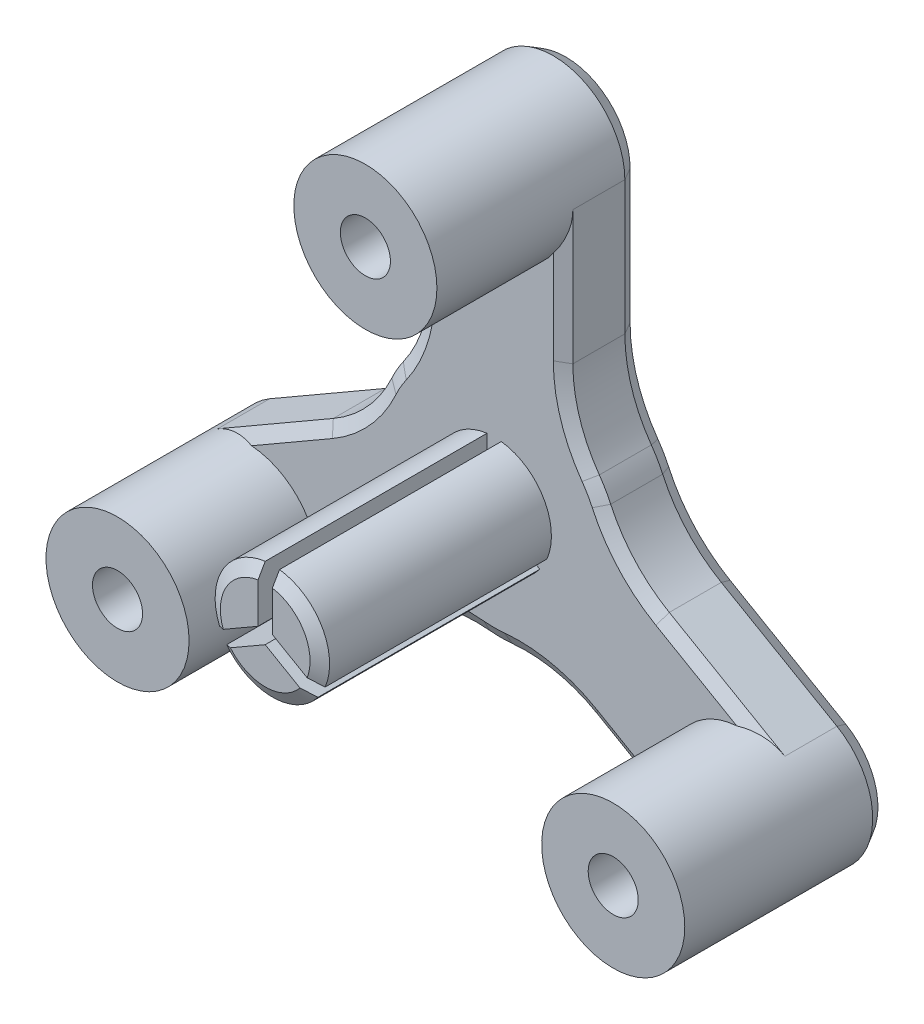
from build123d import *

# Parameters (mm, degrees)
BOSS_EXTRUDE1_DEPTH   = 5
SKETCH2_R             = 5
SKETCH2_R_2           = 1.75
BOSS_EXTRUDE2_DEPTH   = 9
BOSS_EXTRUDE3_DEPTH   = 7
SKETCH4_R             = 1.75
CUT_EXTRUDE1_DEPTH    = 38.137650447
CUT_EXTRUDE3_DEPTH    = 3
CHAMFER1_SIZE         = 0.5
CHAMFER1_SIZE2        = 0.866025404
CHAMFER2_SIZE         = 0.5
CHAMFER2_SIZE_2       = 0.866025404
BOSS_EXTRUDE5_START   = 0.15
SKETCH8_R             = 2.25
SKETCH8_R_2           = 1.75
BOSS_EXTRUDE5_DEPTH   = 2.85
BOSS_EXTRUDE5_2_DEPTH = 2.85
BOSS_EXTRUDE5_3_DEPTH = 2.85


with BuildPart() as part:
    # Sketch1 → Boss-Extrude1 (new body)
    with BuildSketch(Plane.XY):
        with BuildLine():
            Line((-5, 20), (-5, 10.668282009))
            ThreePointArc((-5, 10.668282009), (-5.473946579, 7.626192889), (-6.850861242, 4.872461316))
            ThreePointArc((-6.850861242, 4.872461316), (-7.28054835, 4.20342655), (-7.6451059, 3.496789216))
            ThreePointArc((-7.6451059, 3.496789216), (-9.341450066, 0.927480351), (-11.739003235, -1.004013986))
            Line((-11.739003235, -1.004013986), (-19.820508076, -5.669872981))
            ThreePointArc((-19.820508076, -5.669872981), (-21.650635095, -12.5), (-14.820508076, -14.330127019))
            Line((-14.820508076, -14.330127019), (-6.739003235, -9.664268023))
            ThreePointArc((-6.739003235, -9.664268023), (-3.867503487, -8.553673241), (-0.794244657, -8.369250532))
            ThreePointArc((-0.794244657, -8.369250532), (0, -8.406853099), (0.794244657, -8.369250532))
            ThreePointArc((0.794244657, -8.369250532), (3.867503487, -8.553673241), (6.739003235, -9.664268023))
            Line((6.739003235, -9.664268023), (14.820508076, -14.330127019))
            ThreePointArc((14.820508076, -14.330127019), (21.650635095, -12.5), (19.820508076, -5.669872981))
            Line((19.820508076, -5.669872981), (11.739003235, -1.004013986))
            ThreePointArc((11.739003235, -1.004013986), (9.341450066, 0.927480351), (7.6451059, 3.496789216))
            ThreePointArc((7.6451059, 3.496789216), (7.28054835, 4.20342655), (6.850861242, 4.872461316))
            ThreePointArc((6.850861242, 4.872461316), (5.473946579, 7.626192889), (5, 10.668282009))
            Line((5, 10.668282009), (5, 20))
            ThreePointArc((5, 20), (0, 25), (-5, 20))
        make_face()
    extrude(amount=BOSS_EXTRUDE1_DEPTH)

    # Sketch2 → Boss-Extrude2 (add)
    # profile 1 of 6: a face of its own
    with BuildSketch(Plane.XY.offset(5)):
        with Locations(Location((17.320508076, -10, 0), (0, 0, 240))):
            Circle(SKETCH2_R)
        with Locations((17.320508076, -10)):
            Circle(SKETCH2_R_2, mode=Mode.SUBTRACT)
    # profile 2 of 6: a face of its own
    with BuildSketch(Plane.XY.offset(5)):
        with Locations(Location((-17.320508076, -10, 0), (0, 0, 120))):
            Circle(SKETCH2_R)
        with Locations((-17.320508076, -10)):
            Circle(SKETCH2_R_2, mode=Mode.SUBTRACT)
    # profile 3 of 6: a face of its own
    with BuildSketch(Plane.XY.offset(5)):
        with Locations((0, 20)):
            Circle(SKETCH2_R)
        with Locations((0, 20)):
            Circle(SKETCH2_R_2, mode=Mode.SUBTRACT)
    # profile 4 of 6: a face of its own
    with BuildSketch(Plane.XY.offset(5)):
        with BuildLine():
            ThreePointArc((3.686931771, -1.551300781), (3.464101615, 2), (0.5, 3.968626967))
            Line((0.5, 3.968626967), (0.5, 0.288675135))
            Line((0.5, 0.288675135), (3.686931771, -1.551300781))
        make_face()
    # profile 5 of 6: a face of its own
    with BuildSketch(Plane.XY.offset(5)):
        with BuildLine():
            Line((-0.5, 0.288675135), (-0.5, 3.968626967))
            ThreePointArc((-0.5, 3.968626967), (-3.464101615, 2), (-3.686931771, -1.551300781))
            Line((-3.686931771, -1.551300781), (-0.5, 0.288675135))
        make_face()
    # profile 6 of 6: a face of its own
    with BuildSketch(Plane.XY.offset(5)):
        with BuildLine():
            ThreePointArc((-3.186931771, -2.417326185), (0, -4), (3.186931771, -2.417326185))
            Line((3.186931771, -2.417326185), (0, -0.577350269))
            Line((0, -0.577350269), (-3.186931771, -2.417326185))
        make_face()
    extrude(amount=BOSS_EXTRUDE2_DEPTH)

    # Sketch3 → Boss-Extrude3 (add)
    with BuildSketch(Plane.XY.offset(14)):
        with BuildLine():
            Line((-0.5, 0.288675135), (-0.5, 3.968626967))
            ThreePointArc((-0.5, 3.968626967), (-3.464101615, 2), (-3.686931771, -1.551300781))
            Line((-3.686931771, -1.551300781), (-0.5, 0.288675135))
        make_face()
        with BuildLine():
            Line((0.5, 0.288675135), (3.686931771, -1.551300781))
            ThreePointArc((3.686931771, -1.551300781), (3.464101615, 2), (0.5, 3.968626967))
            Line((0.5, 3.968626967), (0.5, 0.288675135))
        make_face()
        with BuildLine():
            Line((0, -0.577350269), (-3.186931771, -2.417326185))
            ThreePointArc((-3.186931771, -2.417326185), (0, -4), (3.186931771, -2.417326185))
            Line((3.186931771, -2.417326185), (0, -0.577350269))
        make_face()
    extrude(amount=BOSS_EXTRUDE3_DEPTH)

    # Sketch4 → Cut-Extrude1 (cut, through all)
    with BuildSketch(Plane.XY.offset(5)):
        with Locations((17.320508076, -10)):
            Circle(SKETCH4_R)
        with Locations((0, 20)):
            Circle(SKETCH4_R)
        with Locations((-17.320508076, -10)):
            Circle(SKETCH4_R)
    extrude(amount=-CUT_EXTRUDE1_DEPTH, mode=Mode.SUBTRACT)

    # Sketch7 → Cut-Extrude3 (cut)
    with BuildSketch(Plane(origin=(0, 0, 0), x_dir=(-1, 0, 0), z_dir=(0, 0, -1))):
        Polygon((14.495508076, -8.36898549), (14.495508076, -11.63101451), (17.320508076, -13.262029021), (20.145508076, -11.63101451), (20.145508076, -8.36898549), (17.320508076, -6.737970979), align=None)
        Polygon((0, 16.737970979), (2.825, 18.36898549), (2.825, 21.63101451), (0, 23.262029021), (-2.825, 21.63101451), (-2.825, 18.36898549), align=None)
        Polygon((-14.495508076, -8.36898549), (-17.320508076, -6.737970979), (-20.145508076, -8.36898549), (-20.145508076, -11.63101451), (-17.320508076, -13.262029021), (-14.495508076, -11.63101451), align=None)
    extrude(amount=-CUT_EXTRUDE3_DEPTH, mode=Mode.SUBTRACT)

    # Chamfer1
    chamfer1_edges = [part.edges().sort_by_distance(p)[0] for p in [
        (7.28054835, 4.20342655, 0),
        (9.341450066, 0.927480351, 0),
        (15.779755655, -3.336943483, 0),
        (21.650635095, -12.5, 0),
        (10.779755655, -11.997197521, 0),
        (3.867503487, -8.553673241, 0),
        (0, -8.406853099, 0),
        (-3.867503487, -8.553673241, 0),
        (-10.779755655, -11.997197521, 0),
        (-21.650635095, -12.5, 0),
        (-15.779755655, -3.336943483, 0),
        (-9.341450066, 0.927480351, 0),
        (-7.28054835, 4.20342655, 0),
        (-5.473946579, 7.626192889, 0),
        (-5, 15.334141004, 0),
        (0, 25, 0),
        (5, 15.334141004, 0),
        (5.473946579, 7.626192889, 0),
    ]]
    chamfer1_side = [part.faces().sort_by_distance(p)[0] for p in [
        (0, 0, 0),
    ]]
    chamfer(chamfer1_edges, length=CHAMFER1_SIZE, length2=CHAMFER1_SIZE2, reference=chamfer1_side[0])

    # Chamfer2
    # the kernel refuses this chamfer: 0.866025404, 0.5 mm, written as the material it takes off along each edge
    with BuildSketch(Plane(origin=(0, 0, 21), x_dir=(0.421503526327494, 0.9068267625591382, 0), z_dir=(0.9068267625591382, -0.421503526327494, 0))) as chamfer2_piece_1:
        Polygon((4, -CHAMFER2_SIZE), (4 - CHAMFER2_SIZE_2, 0), (4, 0), align=None)
    revolve(axis=Axis((0, 0, 21), (0, 0, 1)), revolution_arc=169.859095672, mode=Mode.SUBTRACT)
    with BuildSketch(Plane(origin=(0, 0, 21), x_dir=(0.574583250044062, -0.8184461428639046, 0), z_dir=(-0.8184461428639046, -0.574583250044062, 0))) as chamfer2_piece_2:
        Polygon((4, -CHAMFER2_SIZE), (4 - CHAMFER2_SIZE_2, 0), (4, 0), align=None)
    revolve(axis=Axis((0, 0, 21), (0, 0, 1)), revolution_arc=169.859095672, mode=Mode.SUBTRACT)
    with BuildSketch(Plane(origin=(0, 0, 21), x_dir=(-0.9960867763715608, -0.08838061969522747, 0), z_dir=(-0.08838061969522747, 0.9960867763715608, 0))) as chamfer2_piece_3:
        Polygon((4, -CHAMFER2_SIZE), (4 - CHAMFER2_SIZE_2, 0), (4, 0), align=None)
    revolve(axis=Axis((0, 0, 21), (0, 0, 1)), revolution_arc=169.859095672, mode=Mode.SUBTRACT)
    with BuildSketch(Plane(origin=(-5, 22.240481985, 5), x_dir=(0.9998132206222079, 0, 0.019326765612700702), z_dir=(0, -1, 0))) as chamfer2_piece_4_section:
        Polygon((CHAMFER2_SIZE_2 * 0.999813220373, -CHAMFER2_SIZE_2 * 0.0193267656079), (-CHAMFER2_SIZE * 0.0193267656127, -CHAMFER2_SIZE * 0.999813220622), (0, 0), align=None)
    chamfer2_piece_4 = extrude(amount=11.572199976, mode=Mode.PRIVATE)
    chamfer2_piece_4 = chamfer2_piece_4 - Plane(origin=(0, 20, 4.828748489), x_dir=(1, 0, 0), z_dir=(0, 0, -1)) * Cylinder(5, 27, mode=Mode.PRIVATE)
    add(chamfer2_piece_4, mode=Mode.SUBTRACT)
    with BuildSketch(Plane(origin=(-15, 10.668282009, 5), x_dir=(1, 0, 0), z_dir=(0, 1, 0))) as chamfer2_piece_5:
        Polygon((10 + CHAMFER2_SIZE_2, 0), (10, CHAMFER2_SIZE), (10, 0), align=None)
    revolve(axis=Axis((-15, 10.668282009, 5), (0, 0, -1)), revolution_arc=35.421152989, mode=Mode.SUBTRACT)
    with BuildSketch(Plane(origin=(0, 0, 5), x_dir=(-0.8149138757719532, 0.5795820693174815, 0), z_dir=(0.5795820693174815, 0.8149138757719532, 0))) as chamfer2_piece_6:
        Polygon((8.406853099 - CHAMFER2_SIZE_2, 0), (8.406853099, -CHAMFER2_SIZE), (8.406853099, 0), align=None)
    revolve(axis=Axis((0, 0, 5), (0, 0, 1)), revolution_arc=10.842305977, mode=Mode.SUBTRACT)
    with BuildSketch(Plane(origin=(-16.739003235, 7.656240052, 5), x_dir=(0.9093897334928682, -0.41594508365620836, 0), z_dir=(0.41594508365620836, 0.9093897334928682, 0))) as chamfer2_piece_7:
        Polygon((10 + CHAMFER2_SIZE_2, 0), (10, CHAMFER2_SIZE), (10, 0), align=None)
    revolve(axis=Axis((-16.739003235, 7.656240052, 5), (0, 0, -1)), revolution_arc=35.421152989, mode=Mode.SUBTRACT)
    with BuildSketch(Plane(origin=(-11.739003235, -1.004013986, 5), x_dir=(0.4999066103111042, -0.8658636480983676, 0.01932676561270069), z_dir=(-0.8660254037844386, -0.5000000000000003, 0))) as chamfer2_piece_8_section:
        Polygon((CHAMFER2_SIZE_2 * 0.999813220373, -CHAMFER2_SIZE_2 * 0.0193267656079), (-CHAMFER2_SIZE * 0.0193267656127, -CHAMFER2_SIZE * 0.999813220622), (0, 0), align=None)
    chamfer2_piece_8 = extrude(amount=11.572199976, mode=Mode.PRIVATE)
    chamfer2_piece_8 = chamfer2_piece_8 - Plane(origin=(-17.320508076, -10, 4.82874849), x_dir=(-0.49999999999999634, 0.8660254037844408, 0), z_dir=(0, 0, -1)) * Cylinder(5, 27, mode=Mode.PRIVATE)
    add(chamfer2_piece_8, mode=Mode.SUBTRACT)
    with BuildSketch(Plane(origin=(-16.760822392, -15.450368012, 5), x_dir=(-0.4999066103111033, 0.8658636480983681, 0.019326765612700702), z_dir=(0.8660254037844392, 0.49999999999999933, 0))) as chamfer2_piece_9_section:
        Polygon((CHAMFER2_SIZE_2 * 0.999813220373, -CHAMFER2_SIZE_2 * 0.0193267656079), (-CHAMFER2_SIZE * 0.0193267656127, -CHAMFER2_SIZE * 0.999813220622), (0, 0), align=None)
    chamfer2_piece_9 = extrude(amount=11.572199976, mode=Mode.PRIVATE)
    chamfer2_piece_9 = chamfer2_piece_9 - Plane(origin=(-17.320508076, -10, 4.828748489), x_dir=(-0.49999999999999634, 0.8660254037844408, 0), z_dir=(0, 0, -1)) * Cylinder(5, 27, mode=Mode.PRIVATE)
    add(chamfer2_piece_9, mode=Mode.SUBTRACT)
    with BuildSketch(Plane(origin=(-1.739003235, -18.324522061, 5), x_dir=(-0.5000000000000002, 0.8660254037844386, 0), z_dir=(-0.8660254037844386, -0.5000000000000002, 0))) as chamfer2_piece_10:
        Polygon((10 + CHAMFER2_SIZE_2, 0), (10, CHAMFER2_SIZE), (10, 0), align=None)
    revolve(axis=Axis((-1.739003235, -18.324522061, 5), (0, 0, -1)), revolution_arc=35.421152989, mode=Mode.SUBTRACT)
    with BuildSketch(Plane(origin=(0, 0, 5), x_dir=(-0.09447585772091267, -0.9955271529736884, 0), z_dir=(-0.9955271529736884, 0.09447585772091267, 0))) as chamfer2_piece_11:
        Polygon((8.406853099 - CHAMFER2_SIZE_2, 0), (8.406853099, -CHAMFER2_SIZE), (8.406853099, 0), align=None)
    revolve(axis=Axis((0, 0, 5), (0, 0, 1)), revolution_arc=10.842305977, mode=Mode.SUBTRACT)
    with BuildSketch(Plane(origin=(15, 10.668282009, 5), x_dir=(-0.814913875771955, -0.579582069317479, 0), z_dir=(0.579582069317479, -0.814913875771955, 0))) as chamfer2_piece_12:
        Polygon((10, CHAMFER2_SIZE), (10 + CHAMFER2_SIZE_2, 0), (10, 0), align=None)
    revolve(axis=Axis((15, 10.668282009, 5), (0, 0, -1)), revolution_arc=35.421152989, mode=Mode.SUBTRACT)
    with BuildSketch(Plane(origin=(1.739003235, -18.324522061, 5), x_dir=(-0.09447585772091491, 0.9955271529736883, 0), z_dir=(-0.9955271529736883, -0.09447585772091491, 0))) as chamfer2_piece_13:
        Polygon((10 + CHAMFER2_SIZE_2, 0), (10, CHAMFER2_SIZE), (10, 0), align=None)
    revolve(axis=Axis((1.739003235, -18.324522061, 5), (0, 0, -1)), revolution_arc=35.421152989, mode=Mode.SUBTRACT)
    with BuildSketch(Plane(origin=(6.739003235, -9.664268023, 5), x_dir=(0.4999066103111033, 0.865863648098368, 0.019326765612700712), z_dir=(0.866025403784439, -0.49999999999999933, 0))) as chamfer2_piece_14_section:
        Polygon((CHAMFER2_SIZE_2 * 0.999813220373, -CHAMFER2_SIZE_2 * 0.0193267656079), (-CHAMFER2_SIZE * 0.0193267656127, -CHAMFER2_SIZE * 0.999813220622), (0, 0), align=None)
    chamfer2_piece_14 = extrude(amount=11.572199976, mode=Mode.PRIVATE)
    chamfer2_piece_14 = chamfer2_piece_14 - Plane(origin=(17.320508076, -10, 4.82874849), x_dir=(-0.5000000000000019, -0.8660254037844376, 0), z_dir=(0, 0, -1)) * Cylinder(5, 27, mode=Mode.PRIVATE)
    add(chamfer2_piece_14, mode=Mode.SUBTRACT)
    with BuildSketch(Plane(origin=(21.760822392, -6.790113974, 5), x_dir=(-0.499906610311104, -0.8658636480983676, 0.01932676561270072), z_dir=(-0.8660254037844387, 0.5000000000000001, 0))) as chamfer2_piece_15_section:
        Polygon((CHAMFER2_SIZE_2 * 0.999813220373, -CHAMFER2_SIZE_2 * 0.0193267656079), (-CHAMFER2_SIZE * 0.0193267656127, -CHAMFER2_SIZE * 0.999813220622), (0, 0), align=None)
    chamfer2_piece_15 = extrude(amount=11.572199976, mode=Mode.PRIVATE)
    chamfer2_piece_15 = chamfer2_piece_15 - Plane(origin=(17.320508076, -10, 4.828748489), x_dir=(-0.5000000000000019, -0.8660254037844376, 0), z_dir=(0, 0, -1)) * Cylinder(5, 27, mode=Mode.PRIVATE)
    add(chamfer2_piece_15, mode=Mode.SUBTRACT)
    with BuildSketch(Plane(origin=(16.739003235, 7.656240052, 5), x_dir=(-0.5000000000000013, -0.8660254037844379, 0), z_dir=(0.8660254037844379, -0.5000000000000013, 0))) as chamfer2_piece_16:
        Polygon((10 + CHAMFER2_SIZE_2, 0), (10, CHAMFER2_SIZE), (10, 0), align=None)
    revolve(axis=Axis((16.739003235, 7.656240052, 5), (0, 0, -1)), revolution_arc=35.421152989, mode=Mode.SUBTRACT)
    with BuildSketch(Plane(origin=(0, 0, 5), x_dir=(0.9093897334928667, 0.41594508365621186, 0), z_dir=(0.41594508365621186, -0.9093897334928667, 0))) as chamfer2_piece_17:
        Polygon((8.406853099 - CHAMFER2_SIZE_2, 0), (8.406853099, -CHAMFER2_SIZE), (8.406853099, 0), align=None)
    revolve(axis=Axis((0, 0, 5), (0, 0, 1)), revolution_arc=10.842305977, mode=Mode.SUBTRACT)
    with BuildSketch(Plane(origin=(5, 10.668282009, 5), x_dir=(0.05789386240267147, 0, -0.9983227437537926), z_dir=(0, 1, 0))) as chamfer2_piece_18_section:
        Polygon((CHAMFER2_SIZE * 0.998322743754, CHAMFER2_SIZE * 0.0578938624027), (-CHAMFER2_SIZE_2 * 0.0578938623883, CHAMFER2_SIZE_2 * 0.998322743505), (0, 0), align=None)
    chamfer2_piece_18 = extrude(amount=11.572199976, mode=Mode.PRIVATE)
    chamfer2_piece_18 = chamfer2_piece_18 - Plane(origin=(0, 20, 4.82874849), x_dir=(1, 0, 0), z_dir=(0, 0, -1)) * Cylinder(5, 27, mode=Mode.PRIVATE)
    add(chamfer2_piece_18, mode=Mode.SUBTRACT)


with BuildPart() as body_2:
    # Sketch8 → Boss-Extrude5 (new body)
    with BuildSketch(Plane(origin=(0, 0, 3), x_dir=(-1, 0, 0), z_dir=(0, 0, -1)).offset(BOSS_EXTRUDE5_START)):
        with Locations((17.320508076, -10)):
            Circle(SKETCH8_R)
        with Locations((17.320508076, -10)):
            Circle(SKETCH8_R_2, mode=Mode.SUBTRACT)
    extrude(amount=BOSS_EXTRUDE5_DEPTH)


with BuildPart() as body_3:
    # Sketch8 → Boss-Extrude5 2 (new body)
    with BuildSketch(Plane(origin=(0, 0, 3), x_dir=(-1, 0, 0), z_dir=(0, 0, -1)).offset(BOSS_EXTRUDE5_START)):
        with Locations((-17.320508076, -10)):
            Circle(SKETCH8_R)
        with Locations((-17.320508076, -10)):
            Circle(SKETCH8_R_2, mode=Mode.SUBTRACT)
    extrude(amount=BOSS_EXTRUDE5_2_DEPTH)


with BuildPart() as body_4:
    # Sketch8 → Boss-Extrude5 3 (new body)
    with BuildSketch(Plane(origin=(0, 0, 3), x_dir=(-1, 0, 0), z_dir=(0, 0, -1)).offset(BOSS_EXTRUDE5_START)):
        with Locations((0, 20)):
            Circle(SKETCH8_R)
        with Locations((0, 20)):
            Circle(SKETCH8_R_2, mode=Mode.SUBTRACT)
    extrude(amount=BOSS_EXTRUDE5_3_DEPTH)


solid = Compound([part.part, body_2.part, body_3.part, body_4.part])
